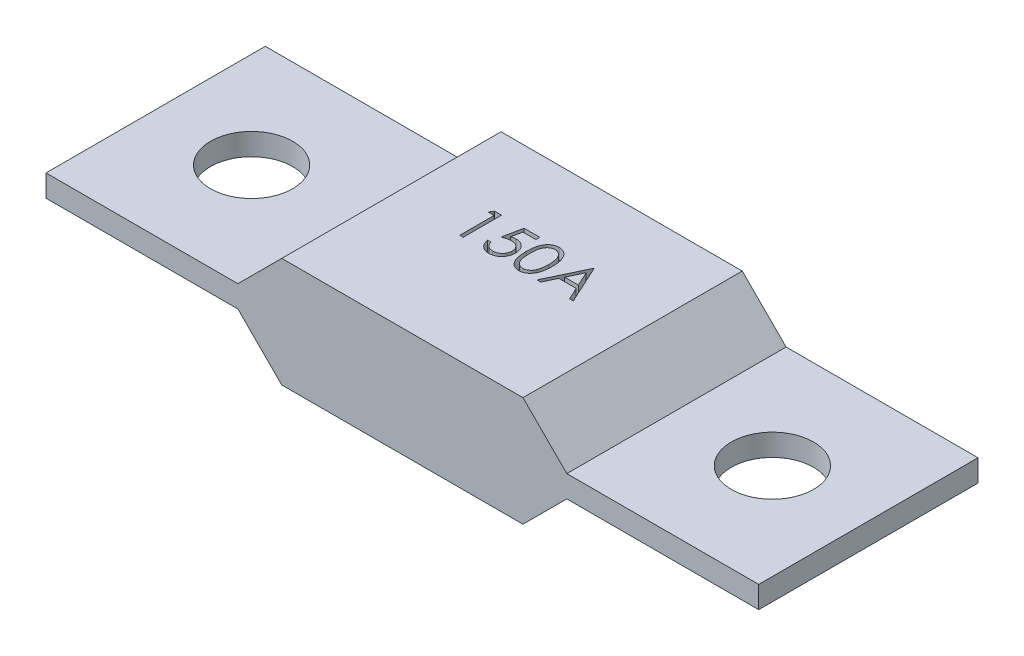
from build123d import *

# Parameters (mm, degrees)
SKETCH1_W             = 17.5
SKETCH1_H             = 20
SKETCH1_R             = 3.75
BOSS_EXTRUDE1_DEPTH   = 2
BOSS_EXTRUDE1_2_DEPTH = 2
SKETCH2_W             = 20
SKETCH2_H             = 10
BOSS_EXTRUDE2_DEPTH   = 30
CHAMFER1_SIZE         = 4
CUT_EXTRUDE1_DEPTH    = 1


with BuildPart() as part:
    # Sketch1 → Boss-Extrude1 (new body)
    with BuildSketch(Plane(origin=(0, 0, 0), x_dir=(1, 0, 0), z_dir=(0, 1, 0))):
        Rectangle(SKETCH1_W, SKETCH1_H)
        with Locations(Location((0, 0, 0), (0, 0, 270))):
            Circle(SKETCH1_R, mode=Mode.SUBTRACT)
    extrude(amount=BOSS_EXTRUDE1_DEPTH)



with BuildPart() as body_2:
    # Sketch1 → Boss-Extrude1 2 (new body)
    with BuildSketch(Plane(origin=(0, 0, 0), x_dir=(1, 0, 0), z_dir=(0, 1, 0))):
        with Locations((47.5, 0)):
            Rectangle(SKETCH1_W, SKETCH1_H)
        with Locations(Location((47.5, 0, 0), (0, 0, 90))):
            Circle(SKETCH1_R, mode=Mode.SUBTRACT)
    extrude(amount=BOSS_EXTRUDE1_2_DEPTH)


with BuildPart() as part_1:
    add(part.part)

    add(body_2.part)  # Boss-Extrude2 merges body 2
    # Sketch2 → Boss-Extrude2 (add)
    with BuildSketch(Plane(origin=(8.75, 0, 0), x_dir=(0, 0, -1), z_dir=(1, 0, 0))):
        with Locations((0, 1)):
            Rectangle(SKETCH2_W, SKETCH2_H)
    extrude(amount=BOSS_EXTRUDE2_DEPTH)

    # Chamfer1
    chamfer1_edges = [part_1.edges().sort_by_distance(p)[0] for p in [
        (38.75, -4, 0),
        (38.75, 6, 0),
        (8.75, -4, 0),
        (8.75, 6, 0),
    ]]
    chamfer(chamfer1_edges, length=CHAMFER1_SIZE - 0.0001)  # a hair under: the kernel refuses the full size

    # Sketch3 → Cut-Extrude1 (cut)
    # profile 1 of 4: a face of its own
    with BuildSketch(Plane(origin=(0, 6, 0), x_dir=(1, 0, 0), z_dir=(0, 1, 0))):
        Polygon((18.712150258, 3.432768689), (19.359285675, 3.432768689), (19.359285675, -0.067231311), (19.04518311, -0.067231311), (19.04518311, 3.07379433), (18.506721572, 3.07379433), align=None)
    # profile 2 of 4: a face of its own
    with BuildSketch(Plane(origin=(0, 6, 0), x_dir=(1, 0, 0), z_dir=(0, 1, 0))):
        with BuildLine():
            Line((22.859285675, 3.432768689), (22.859285675, 3.07379433))
            Line((22.859285675, 3.07379433), (21.668780867, 3.07379433))
            Line((21.668780867, 3.07379433), (21.480179104, 2.153221414))
            add(Edge.make_bspline(
                [(21.480179104, 2.153221414), (21.517234978, 2.163451685), (21.589024874, 2.183271219), (21.694984735, 2.205276989), (21.795576939, 2.218542433), (21.860852309, 2.220353744), (21.892438719, 2.221230228)],
                knots=[0, 0, 0, 0, 1.100273476, 2.13160584, 3.095893838, 4, 4, 4, 4], degree=3))
            add(Edge.make_bspline(
                [(21.892438719, 2.221230228), (21.931522459, 2.220384292), (22.008370856, 2.218720971), (22.120809803, 2.202749122), (22.228142697, 2.177609207), (22.330145067, 2.142488685), (22.427005617, 2.097578952), (22.517833179, 2.041479012), (22.603991092, 1.975945681), (22.683933686, 1.900600669), (22.756457994, 1.817679052), (22.820223984, 1.728521181), (22.874386574, 1.633993519), (22.917947329, 1.53319291), (22.952731663, 1.427233756), (22.975883658, 1.315001174), (22.991300367, 1.197553054), (22.993022753, 1.117248484), (22.993901059, 1.076298337)],
                knots=[0, 0, 0, 0, 1.052922333, 2.070308379, 3.05430497, 4.020497103, 4.973039431, 5.925935799, 6.892292201, 7.88610001, 8.88166317, 9.857072816, 10.836096531, 11.812156883, 12.81219415, 13.836441305, 14.89672472, 16, 16, 16, 16], degree=3))
            add(Edge.make_bspline(
                [(22.993901059, 1.076298337), (22.993235984, 1.047776116), (22.991914821, 0.991117129), (22.985196234, 0.906972928), (22.972260518, 0.824610095), (22.954892793, 0.744017703), (22.932350375, 0.665348331), (22.905061322, 0.588376803), (22.871665294, 0.513582196), (22.835033919, 0.440256801), (22.793787441, 0.370058294), (22.748008933, 0.304409307), (22.699643442, 0.242325026), (22.647602057, 0.184471293), (22.591401062, 0.131228275), (22.531721095, 0.082279994), (22.469038376, 0.036798663), (22.402383133, -0.003369532), (22.33324065, -0.040332488), (22.260612433, -0.070656025), (22.186151733, -0.097766553), (22.108786857, -0.119376081), (22.028693045, -0.136308636), (21.945738269, -0.147809236), (21.860357599, -0.156185674), (21.802482587, -0.156710031), (21.773248014, -0.156974901)],
                knots=[0, 0, 0, 0, 1.056347294, 2.098418968, 3.122841568, 4.141288669, 5.149314143, 6.15115421, 7.162517403, 8.180376062, 9.185164535, 10.17417709, 11.141909838, 12.097768115, 13.052685741, 14.0056014, 14.954263652, 15.917497458, 16.885230207, 17.854509472, 18.828990115, 19.81800267, 20.826176721, 21.857883937, 22.917946725, 24, 24, 24, 24], degree=3))
            add(Edge.make_bspline(
                [(21.773248014, -0.156974901), (21.738373834, -0.156284063), (21.669763003, -0.15492492), (21.569242436, -0.140706435), (21.47252783, -0.120342519), (21.380397729, -0.089706249), (21.292026465, -0.051318954), (21.208603747, -0.002802783), (21.127997971, 0.052176321), (21.053485935, 0.117056674), (20.984329821, 0.187972356), (20.922423312, 0.264929997), (20.867289736, 0.346659439), (20.819811989, 0.433557593), (20.779313967, 0.525396124), (20.747498979, 0.622519125), (20.721820624, 0.724419129), (20.710957204, 0.794572639), (20.705439521, 0.830204587)],
                knots=[0, 0, 0, 0, 1.0467383, 2.05933395, 3.04377827, 4.011590433, 4.970194871, 5.932262533, 6.905835911, 7.896367577, 8.894135286, 9.877477877, 10.858688626, 11.851381753, 12.8477658, 13.868841284, 14.917554742, 16, 16, 16, 16], degree=3))
            Line((20.705439521, 0.830204587), (21.019542085, 0.830204587))
            add(Edge.make_bspline(
                [(21.019542085, 0.830204587), (21.027270642, 0.796828134), (21.042125359, 0.732676739), (21.074731107, 0.642545398), (21.114596983, 0.562226174), (21.162001331, 0.490656591), (21.218551362, 0.428247594), (21.283080791, 0.372630532), (21.355428514, 0.322455402), (21.435821743, 0.280632635), (21.520634823, 0.244963882), (21.609402033, 0.221212187), (21.699706379, 0.204511294), (21.760784749, 0.202839533), (21.791477181, 0.201999458)],
                knots=[0, 0, 0, 0, 1.136247022, 2.183929868, 3.172523383, 4.106158343, 5.02341133, 5.958108904, 6.928429099, 7.938127109, 8.96079061, 9.975095812, 10.982467395, 12, 12, 12, 12], degree=3))
            add(Edge.make_bspline(
                [(21.791477181, 0.201999458), (21.821435625, 0.202820236), (21.880424048, 0.204436355), (21.967235434, 0.216875367), (22.051048308, 0.236032938), (22.131035665, 0.264702793), (22.208597205, 0.299547512), (22.281770975, 0.344262587), (22.352673852, 0.395722606), (22.419101986, 0.454679236), (22.479941435, 0.51964893), (22.533697556, 0.589126324), (22.57847447, 0.66324317), (22.616208579, 0.740716323), (22.644861877, 0.82239488), (22.665302859, 0.907896056), (22.677305917, 0.997431036), (22.678957097, 1.058500346), (22.679798495, 1.089619651)],
                knots=[0, 0, 0, 0, 1.027316725, 2.022795036, 3.002884548, 3.971462791, 4.93288096, 5.914575861, 6.907176829, 7.935150275, 8.956128384, 9.956726525, 10.942570165, 11.921478529, 12.907843606, 13.90538589, 14.932640048, 16, 16, 16, 16], degree=3))
            add(Edge.make_bspline(
                [(22.679798495, 1.089619651), (22.679140016, 1.117695402), (22.677851136, 1.172649691), (22.667320565, 1.253048898), (22.649003593, 1.32912194), (22.623579713, 1.401236174), (22.591300205, 1.469459616), (22.551853893, 1.533862677), (22.504500495, 1.59359651), (22.450408607, 1.648689064), (22.391150566, 1.699533938), (22.325706823, 1.742878025), (22.255446896, 1.779341942), (22.181217297, 1.810809941), (22.101252398, 1.833410686), (22.017135766, 1.850378572), (21.927959058, 1.860193934), (21.86698837, 1.861555823), (21.835647854, 1.862255869)],
                knots=[0, 0, 0, 0, 1.045622112, 2.046656509, 3.013763289, 3.955457236, 4.890082067, 5.820317437, 6.762574623, 7.722996705, 8.69280354, 9.665887285, 10.63943826, 11.638615906, 12.663482002, 13.728887084, 14.832589034, 16, 16, 16, 16], degree=3))
            add(Edge.make_bspline(
                [(21.835647854, 1.862255869), (21.808518925, 1.861675278), (21.75250457, 1.860476504), (21.666581743, 1.851650007), (21.57629002, 1.837410713), (21.481975525, 1.817824465), (21.383355017, 1.792193389), (21.280636616, 1.761478888), (21.173604349, 1.724756889), (21.101486625, 1.697024676), (21.06441388, 1.682768689)],
                knots=[0, 0, 0, 0, 0.817624296, 1.688186739, 2.600797293, 3.572016777, 4.590301741, 5.671205678, 6.80286297, 8, 8, 8, 8], degree=3))
            Line((21.06441388, 1.682768689), (21.423388239, 3.432768689))
            Line((21.423388239, 3.432768689), (22.859285675, 3.432768689))
        make_face()
    # profile 3 of 4: a face of its own
    with BuildSketch(Plane(origin=(0, 6, 0), x_dir=(1, 0, 0), z_dir=(0, 1, 0))):
        with BuildLine():
            add(Edge.make_bspline(
                [(23.352875418, 1.681366446), (23.353203436, 1.737463833), (23.353840616, 1.846433818), (23.360929037, 2.00521846), (23.37270438, 2.154178749), (23.388841752, 2.293321815), (23.408479733, 2.422683579), (23.434695219, 2.541918336), (23.464508022, 2.651577943), (23.499060468, 2.752019991), (23.538048257, 2.844597694), (23.580482517, 2.931022896), (23.628047312, 3.011164828), (23.678024225, 3.086302619), (23.732436296, 3.155206313), (23.789735087, 3.218848976), (23.852156963, 3.275759726), (23.917579971, 3.327606029), (23.986596436, 3.3730555), (24.057239102, 3.413088239), (24.129994208, 3.447288106), (24.205060391, 3.474178542), (24.281762949, 3.496389389), (24.360370015, 3.511578336), (24.441011379, 3.521135245), (24.495442814, 3.522048913), (24.523047694, 3.522512279)],
                knots=[0, 0, 0, 0, 1.646270934, 3.197905019, 4.663502075, 6.030701355, 7.308322542, 8.50163776, 9.611534131, 10.641858119, 11.616356847, 12.558055219, 13.465016945, 14.349605745, 15.204443733, 16.039544428, 16.859896111, 17.680448484, 18.487036065, 19.28249412, 20.06191084, 20.843045899, 21.620316918, 22.403196591, 23.190181807, 24, 24, 24, 24], degree=3))
            add(Edge.make_bspline(
                [(24.523047694, 3.522512279), (24.550883172, 3.522024464), (24.606239181, 3.521054353), (24.688079556, 3.51173041), (24.768029238, 3.496259287), (24.845747377, 3.474338313), (24.921872363, 3.447142636), (24.995808771, 3.413055519), (25.068015853, 3.373376652), (25.13734614, 3.326752774), (25.204560755, 3.274770498), (25.268008718, 3.216007829), (25.327695804, 3.15105811), (25.38437111, 3.080616246), (25.436426707, 3.003331161), (25.486000139, 2.920547051), (25.530372175, 2.830816187), (25.57310685, 2.735635719), (25.609993837, 2.63237206), (25.643260082, 2.521607299), (25.670139051, 2.402033113), (25.692528323, 2.274276867), (25.709873219, 2.137869384), (25.722505861, 1.993103069), (25.729178946, 1.839882678), (25.730435647, 1.735124829), (25.731080546, 1.681366446)],
                knots=[0, 0, 0, 0, 0.810914788, 1.612654377, 2.396697861, 3.181598691, 3.963628158, 4.749916497, 5.551656086, 6.361998678, 7.18212741, 8.025565596, 8.878627764, 9.750805457, 10.657531673, 11.591944965, 12.560506719, 13.57287815, 14.630710178, 15.753379473, 16.941251878, 18.199788006, 19.531962791, 20.947069417, 22.433333509, 24, 24, 24, 24], degree=3))
            add(Edge.make_bspline(
                [(25.731080546, 1.681366446), (25.730428962, 1.627842538), (25.729159376, 1.523553386), (25.722580669, 1.37102241), (25.709622038, 1.227024367), (25.69341205, 1.091213905), (25.670961087, 0.964156286), (25.64335592, 0.845411837), (25.612705598, 0.734467766), (25.574870803, 0.632232954), (25.533460093, 0.537281231), (25.488404897, 0.448614083), (25.440135071, 0.36544779), (25.387546326, 0.288448043), (25.331492913, 0.217069386), (25.270775124, 0.152571764), (25.207104539, 0.093401092), (25.139692123, 0.040749464), (25.069280572, -0.00533534), (24.997321495, -0.046549191), (24.922538111, -0.079781886), (24.846625159, -0.108316927), (24.768496793, -0.130117379), (24.688250402, -0.145191234), (24.606294166, -0.155763083), (24.550892601, -0.156569563), (24.523047694, -0.156974901)],
                knots=[0, 0, 0, 0, 1.561518951, 3.042555995, 4.452378317, 5.7783523, 7.031515105, 8.214008947, 9.334062868, 10.386615937, 11.391082383, 12.354592575, 13.286541444, 14.194233754, 15.072674879, 15.931287219, 16.775624067, 17.606195743, 18.42308326, 19.229000347, 20.022332153, 20.807536673, 21.593273796, 22.3848459, 23.188221202, 24, 24, 24, 24], degree=3))
            add(Edge.make_bspline(
                [(24.523047694, -0.156974901), (24.49544358, -0.156508545), (24.441013655, -0.155588983), (24.36036123, -0.146075252), (24.282078786, -0.130779748), (24.205780032, -0.109363144), (24.131073517, -0.083148308), (24.05897723, -0.048994624), (23.988689547, -0.009660555), (23.920397991, 0.035134866), (23.85538583, 0.086456549), (23.793287224, 0.143220838), (23.735662205, 0.206844249), (23.68202811, 0.276322172), (23.631054021, 0.351015415), (23.584164648, 0.431943788), (23.540793794, 0.518786398), (23.501150303, 0.612104309), (23.46600164, 0.713259237), (23.434953932, 0.823408415), (23.410439774, 0.943524051), (23.389456819, 1.072641418), (23.372532436, 1.211315349), (23.360978111, 1.359621127), (23.353836796, 1.517466336), (23.353201725, 1.62573611), (23.352875418, 1.681366446)],
                knots=[0, 0, 0, 0, 0.810891512, 1.598919785, 2.382837074, 3.152667961, 3.926044502, 4.706494248, 5.493654104, 6.291793342, 7.103789334, 7.925228297, 8.761435821, 9.622817696, 10.50288917, 11.416980706, 12.369136599, 13.353924996, 14.394355917, 15.514179734, 16.714354668, 17.994756427, 19.357759367, 20.818452758, 22.365282078, 24, 24, 24, 24], degree=3))
        make_face()
        with BuildLine():
            add(Edge.make_bspline(
                [(23.666977982, 1.682768689), (23.667097429, 1.63601999), (23.667329253, 1.545289946), (23.673385453, 1.413446685), (23.681635685, 1.290476356), (23.692276982, 1.176222819), (23.708079931, 1.071072807), (23.725786719, 0.974303124), (23.747334808, 0.886425887), (23.772829826, 0.806838076), (23.801868923, 0.734189007), (23.833574787, 0.666587792), (23.86763551, 0.603235856), (23.90575466, 0.544702248), (23.947269723, 0.490796083), (23.991242983, 0.440563251), (24.039315567, 0.39576627), (24.105819309, 0.342039415), (24.193615784, 0.286520281), (24.304236239, 0.238174191), (24.41790469, 0.207791735), (24.49505594, 0.203927979), (24.533564521, 0.201999458)],
                knots=[0, 0, 0, 0, 1.459021318, 2.831673884, 4.118529203, 5.306027144, 6.411944654, 7.436330062, 8.375795394, 9.233974572, 10.042671642, 10.816086306, 11.563610507, 12.285937304, 12.993564865, 13.685989202, 14.367179055, 15.041617293, 16.353048772, 17.594441528, 18.799311195, 20, 20, 20, 20], degree=3))
            add(Edge.make_bspline(
                [(24.533564521, 0.201999458), (24.572322192, 0.203597239), (24.649757516, 0.206789502), (24.762891311, 0.237588239), (24.872721581, 0.284057779), (24.958793521, 0.339005284), (25.024276065, 0.391333614), (25.071193055, 0.435948262), (25.114255103, 0.485904129), (25.155097178, 0.539803425), (25.192556254, 0.598675909), (25.226619391, 0.662238485), (25.257702739, 0.730667663), (25.275411785, 0.778437402), (25.284465963, 0.802860837)],
                knots=[0, 0, 0, 0, 1.353760809, 2.704726607, 4.075137775, 5.516104923, 6.260822281, 7.007110065, 7.778089737, 8.566572457, 9.372053459, 10.217411131, 11.088608312, 12, 12, 12, 12], degree=3))
            add(Edge.make_bspline(
                [(25.284465963, 0.802860837), (25.295017731, 0.834090576), (25.316442345, 0.89750034), (25.344054119, 0.995863992), (25.365799518, 1.099066756), (25.385362884, 1.206491873), (25.39871594, 1.318931574), (25.409463753, 1.436037958), (25.41579444, 1.55789932), (25.416579191, 1.640694311), (25.416977982, 1.682768689)],
                knots=[0, 0, 0, 0, 0.884706709, 1.796334032, 2.740027952, 3.714592787, 4.726048262, 5.777819803, 6.87074269, 8, 8, 8, 8], degree=3))
            add(Edge.make_bspline(
                [(25.416977982, 1.682768689), (25.416427793, 1.724836262), (25.415351505, 1.807129426), (25.411237518, 1.927647607), (25.400613943, 2.042115368), (25.388814824, 2.151025841), (25.371417603, 2.253776143), (25.352659796, 2.351226449), (25.327458584, 2.442169474), (25.300538809, 2.528029055), (25.269728413, 2.60782971), (25.235812679, 2.681943496), (25.19959092, 2.750728221), (25.16024868, 2.813995162), (25.118252997, 2.872027705), (25.072495448, 2.9236623), (25.024791075, 2.970499268), (24.957973889, 3.023961837), (24.870499599, 3.078473533), (24.761653952, 3.128639292), (24.648383308, 3.157447585), (24.571809854, 3.161509272), (24.533564521, 3.16353792)],
                knots=[0, 0, 0, 0, 1.31362396, 2.569729283, 3.763502607, 4.902122613, 5.988968491, 7.01645872, 7.998833611, 8.933434873, 9.825090667, 10.667526885, 11.477055099, 12.250526234, 12.991942729, 13.710640831, 14.402115721, 15.076753259, 16.378508321, 17.609869233, 18.806226677, 20, 20, 20, 20], degree=3))
            add(Edge.make_bspline(
                [(24.533564521, 3.16353792), (24.494853929, 3.161506473), (24.417362223, 3.157439879), (24.302914268, 3.128746626), (24.193209917, 3.07873366), (24.105966942, 3.023781287), (24.039103155, 2.971442976), (23.992020462, 2.926056522), (23.94787429, 2.876410267), (23.90720659, 2.822008353), (23.869117307, 2.763542985), (23.834136294, 2.70055422), (23.802618964, 2.632722856), (23.773534428, 2.560106421), (23.74796164, 2.480525476), (23.726867677, 2.392756483), (23.707380624, 2.296294591), (23.693585355, 2.190575083), (23.681321599, 2.07629293), (23.673440251, 1.953015611), (23.667308994, 1.820951231), (23.667090529, 1.729752073), (23.666977982, 1.682768689)],
                knots=[0, 0, 0, 0, 1.207732386, 2.417664972, 3.655092373, 4.956220595, 5.625982001, 6.301752483, 6.994047911, 7.697131622, 8.419323945, 9.170223765, 9.943494443, 10.752040957, 11.610060368, 12.549350801, 13.567764191, 14.679664412, 15.874934091, 17.154273443, 18.533957287, 20, 20, 20, 20], degree=3))
        make_face(mode=Mode.SUBTRACT)
    # profile 4 of 4: a face of its own
    with BuildSketch(Plane(origin=(0, 6, 0), x_dir=(1, 0, 0), z_dir=(0, 1, 0))):
        Polygon((27.79518311, 3.432768689), (29.410567726, -0.067231311), (29.069121412, -0.067231311), (28.551693527, 1.054563561), (26.965054905, 1.054563561), (26.432903463, -0.067231311), (26.090054905, -0.067231311), (27.750311316, 3.432768689), align=None)
        Polygon((27.769241604, 2.750577183), (27.135427501, 1.41353792), (28.386228784, 1.41353792), align=None, mode=Mode.SUBTRACT)
    extrude(amount=-CUT_EXTRUDE1_DEPTH, mode=Mode.SUBTRACT)


solid = part_1.part
